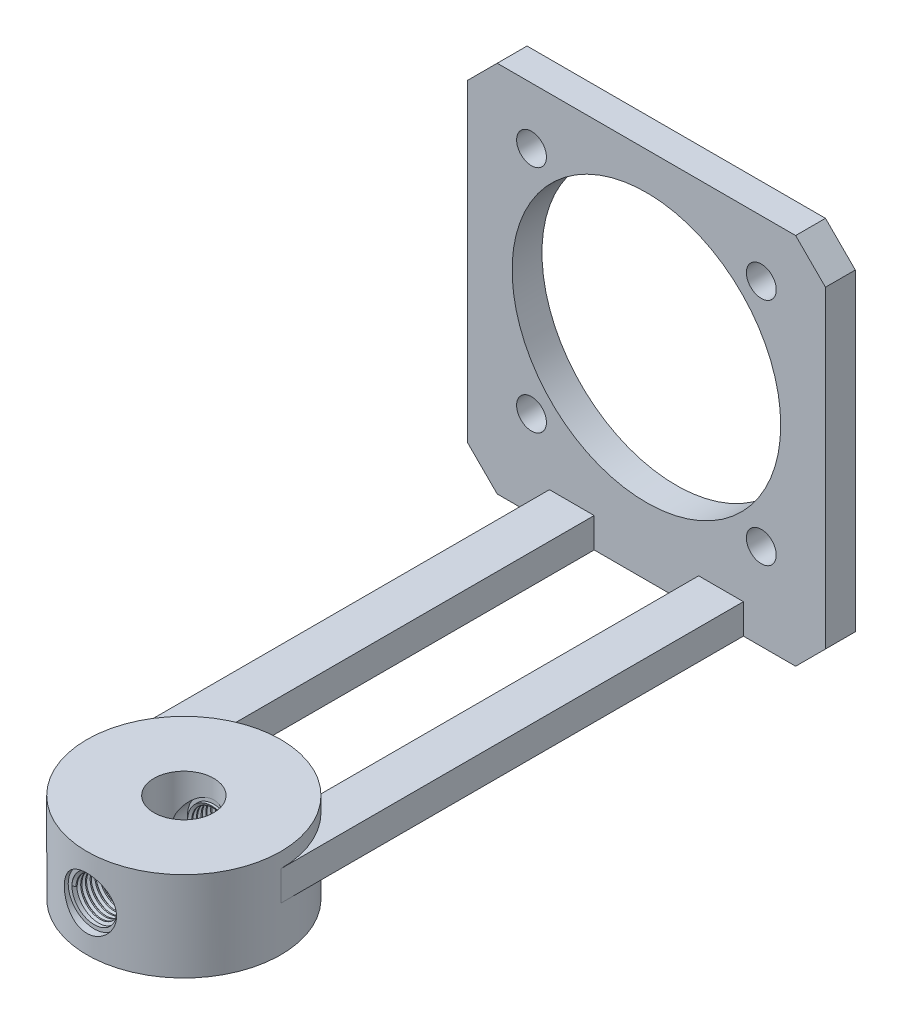
from build123d import *

# Parameters (mm, degrees)
SKETCH_2_R           = 6.5
EXTRUDE_1_DEPTH      = 2
SKETCH_3_R           = 2
CUT_EXTRUDE_2_DEPTH  = 5
EXTRUDE_START        = -2
EXTRUDE_2_DEPTH      = 2
EXTRUDE_3_DEPTH      = 2
SKETCH_22_R          = 9
SKETCH_22_R_2        = 1
CUT_EXTRUDE_4_DEPTH  = 2
CHAMFER_1_SIZE       = 2
CUT_EXTRUDE_5_DEPTH  = 10
SKETCH_26_R          = 6.5
EXTRUDE_5_DEPTH      = 1
EXTRUDE_START_2      = 3
SKETCH_27_R          = 6.5
EXTRUDE_6_DEPTH      = 3
SKETCH_28_R          = 2
CUT_EXTRUDE_7_DEPTH  = 45.911023146
SKETCH_29_R          = 1.75
CUT_EXTRUDE_8_DEPTH  = 2
SKETCH_54_R          = 1.5
CUT_EXTRUDE_10_DEPTH = 4
SKETCH_55_R          = 1.75
CUT_EXTRUDE_11_DEPTH = 4
THREAD_6_PITCH       = 0.3175
CUT_EXTRUDE_START    = -4
SKETCH_60_R          = 1.5
CUT_EXTRUDE_12_DEPTH = 4
SKETCH_61_R          = 1.75
CUT_EXTRUDE_13_DEPTH = 4
THREAD_7_PITCH       = 0.3175


with BuildPart() as part:
    # 草图2 → 凸台-拉伸1 (new body)
    with BuildSketch(Plane(origin=(0, 0, 0), x_dir=(1, 0, 0), z_dir=(0, 1, 0))):
        with Locations(Location((0, 0, 0), (0, 0, 270))):
            Circle(SKETCH_2_R)
    extrude(amount=EXTRUDE_1_DEPTH)

    # 草图3 → 切除-拉伸2 (cut, symmetric)
    with BuildSketch(Plane(origin=(0, 2, 0), x_dir=(1, 0, 0), z_dir=(0, 1, 0))):
        with Locations(Location((0, 0, 0), (0, 0, 270))):
            Circle(SKETCH_3_R)
    extrude(amount=CUT_EXTRUDE_2_DEPTH, both=True, mode=Mode.SUBTRACT)

    # 草图4 → 凸台-拉伸2 (add)
    with BuildSketch(Plane(origin=(0, 2, 0), x_dir=(1, 0, 0), z_dir=(0, 1, 0)).offset(EXTRUDE_START)):
        with BuildLine():
            Line((6.5, 0), (6.5, 31))
            Line((6.5, 31), (3.899148682, 31))
            Line((3.899148682, 31), (-4.100851318, 31))
            Line((-4.100851318, 31), (-6.5, 31))
            Line((-6.5, 31), (-6.5, 0))
            ThreePointArc((-6.5, 0), (0, 6.5), (6.5, 0))
        make_face()
    extrude(amount=EXTRUDE_2_DEPTH)

    # 草图21 → 凸台-拉伸3 (add)
    with BuildSketch(Plane(origin=(0, 0, -31), x_dir=(-1, 0, 0), z_dir=(0, 0, -1))):
        Polygon((0, 0), (12, 0), (12, 25), (-12, 25), (-12, 0), align=None)
    extrude(amount=EXTRUDE_3_DEPTH)

    # 草图22 → 切除-拉伸4 (cut)
    with BuildSketch(Plane.XY.offset(-31)):
        with Locations((0, 13.5)):
            Circle(SKETCH_22_R)
        with Locations((7.7, 21.2)):
            Circle(SKETCH_22_R_2)
        with Locations((-7.7, 21.2)):
            Circle(SKETCH_22_R_2)
        with Locations((-7.7, 5.8)):
            Circle(SKETCH_22_R_2)
        with Locations((7.7, 5.8)):
            Circle(SKETCH_22_R_2)
    extrude(amount=-CUT_EXTRUDE_4_DEPTH, mode=Mode.SUBTRACT)

    # 倒角1
    chamfer_1_edges = [part.edges().sort_by_distance(p)[0] for p in [
        (12, 0, -32),
        (-12, 0, -32),
        (-12, 25, -32),
        (12, 25, -32),
    ]]
    chamfer(chamfer_1_edges, length=CHAMFER_1_SIZE)

    # 草图23 → 切除-拉伸5 (cut)
    with BuildSketch(Plane.XZ):
        with BuildLine():
            ThreePointArc((3.5, -5.477225575), (0, -6.5), (-3.5, -5.477225575))
            Line((-3.5, -5.477225575), (-3.5, -31))
            Line((-3.5, -31), (3.5, -31))
            Line((3.5, -31), (3.5, -5.477225575))
        make_face()
    extrude(amount=-CUT_EXTRUDE_5_DEPTH, mode=Mode.SUBTRACT)

    # 草图26 → 凸台-拉伸5 (add)
    with BuildSketch(Plane(origin=(0, 2, 0), x_dir=(1, 0, 0), z_dir=(0, 1, 0))):
        with Locations(Location((0, 0, 0), (0, 0, 57.421029607))):
            Circle(SKETCH_26_R)
    extrude(amount=EXTRUDE_5_DEPTH)

    # 草图27 → 凸台-拉伸6 (add)
    with BuildSketch(Plane.XZ.offset(EXTRUDE_START_2)):
        with Locations(Location((0, 0, 0), (0, 0, 270))):
            Circle(SKETCH_27_R)
    extrude(amount=-EXTRUDE_6_DEPTH)

    # 草图28 → 切除-拉伸7 (cut, through all)
    with BuildSketch(Plane.XZ.offset(3)):
        with Locations(Location((0, 0, 0), (0, 0, 90))):
            Circle(SKETCH_28_R)
    extrude(amount=-CUT_EXTRUDE_7_DEPTH, mode=Mode.SUBTRACT)

    # 草图29 → 切除-拉伸8 (cut, symmetric)
    with BuildSketch(Plane.XY):
        Circle(SKETCH_29_R)
    extrude(amount=CUT_EXTRUDE_8_DEPTH, both=True, mode=Mode.SUBTRACT)

    # 草图54 → 切除-拉伸10 (cut)
    with BuildSketch(Plane.XY.offset(-2)):
        Circle(SKETCH_54_R)
    extrude(amount=-CUT_EXTRUDE_10_DEPTH, mode=Mode.SUBTRACT)

    # 草图55 → 切除-拉伸11 (cut)
    with BuildSketch(Plane.XY.offset(-6)):
        Circle(SKETCH_55_R)
    extrude(amount=-CUT_EXTRUDE_11_DEPTH, mode=Mode.SUBTRACT)

    # 螺纹线6: arcs per turn and ends read off the stored shape
    # 螺纹线6: the profile of 螺纹线轮廓10 profile screwed along a right-hand helix through 12.598425 turns, 6 arcs to a turn; built about Z, then put on its axis
    thread_6_z = Axis((0, 0, 0), (0, 0, 1))
    thread_6_corners = [(1.5003, 0, -0.000173205), (1.5003, 0, 0.277985704), (1.328148085, 0, 0.17859375), (1.328148085, 0, 0.09921875)]
    with BuildLine(mode=Mode.PRIVATE) as thread_6_profile:
        Line(thread_6_corners[0], thread_6_corners[1])
        Line(thread_6_corners[1], thread_6_corners[2])
        Line(thread_6_corners[2], thread_6_corners[3])
        Line(thread_6_corners[3], thread_6_corners[0])
    thread_6_cap = Face(thread_6_profile.wire())
    thread_6_turn_angles = [0, 30, 60, 90, 120, 150, 180, 210, 240, 270, 300, 330, 360]
    thread_6_turn_weights = [1, 0.8660254037844387, 1, 0.8660254037844387, 1, 0.8660254037844387, 1, 0.8660254037844387, 1, 0.8660254037844387, 1, 0.8660254037844387, 1]
    thread_6_turn_rails = [Edge.make_bspline([Vector(p[0], p[1], 0).rotate(thread_6_z, thread_6_turn_angles[k]) / thread_6_turn_weights[k] + Vector(0, 0, p[2] + THREAD_6_PITCH * thread_6_turn_angles[k] / 360) for k in range(13)], [0, 0, 0, 1, 1, 2, 2, 3, 3, 4, 4, 5, 5, 6, 6, 6], 2, thread_6_turn_weights) for p in thread_6_corners]
    thread_6_turn_sides = [Face.make_surface_from_curves(thread_6_turn_rails[p[0]], thread_6_turn_rails[p[1]]) for p in [(0, 1), (1, 2), (2, 3), (3, 0)]]
    thread_6_last_angles = [4320, 4350, 4380, 4410, 4440, 4470, 4500, 4517.716535433, 4535.433070866]
    thread_6_last_weights = [1, 0.8660254037844387, 1, 0.8660254037844387, 1, 0.8660254037844387, 1, 0.9525736983244454, 1]
    thread_6_last_rails = [Edge.make_bspline([Vector(p[0], p[1], 0).rotate(thread_6_z, thread_6_last_angles[k]) / thread_6_last_weights[k] + Vector(0, 0, p[2] + THREAD_6_PITCH * thread_6_last_angles[k] / 360) for k in range(9)], [0, 0, 0, 1, 1, 2, 2, 3, 3, 4, 4, 4], 2, thread_6_last_weights) for p in thread_6_corners]
    thread_6_last_sides = [Face.make_surface_from_curves(thread_6_last_rails[p[0]], thread_6_last_rails[p[1]]) for p in [(0, 1), (1, 2), (2, 3), (3, 0)]]
    thread_6 = Plane(origin=(0, 0, -6), x_dir=(1, 0, 0), z_dir=(0, 0, 1)) * Solid(Shell([*[p.moved(Location((0, 0, THREAD_6_PITCH * i))) for i in range(12) for p in thread_6_turn_sides], *thread_6_last_sides, thread_6_cap, thread_6_cap.rotate(thread_6_z, 4535.433070866).moved(Location((0, 0, THREAD_6_PITCH * 4535.433070866 / 360)))]))
    add(thread_6)

    # 草图60 → 切除-拉伸12 (cut)
    with BuildSketch(Plane(origin=(0, 0, 2), x_dir=(-1, 0, 0), z_dir=(0, 0, -1)).offset(CUT_EXTRUDE_START)):
        Circle(SKETCH_60_R)
    extrude(amount=CUT_EXTRUDE_12_DEPTH, mode=Mode.SUBTRACT)

    # 草图61 → 切除-拉伸13 (cut)
    with BuildSketch(Plane(origin=(0, 0, 6), x_dir=(-1, 0, 0), z_dir=(0, 0, -1)).offset(CUT_EXTRUDE_START)):
        with Locations(Location((0, 0, 0), (0, 0, 180))):
            Circle(SKETCH_61_R)
    extrude(amount=CUT_EXTRUDE_13_DEPTH, mode=Mode.SUBTRACT)

    # 螺纹线7: arcs per turn and ends read off the stored shape
    # 螺纹线7: the profile of 螺纹线轮廓11 profile screwed along a right-hand helix through 12.598425 turns, 6 arcs to a turn; built about Z, then put on its axis
    thread_7_z = Axis((0, 0, 0), (0, 0, 1))
    thread_7_corners = [(1.5003, 0, -0.000173205), (1.5003, 0, 0.277985704), (1.328148085, 0, 0.17859375), (1.328148085, 0, 0.09921875)]
    with BuildLine(mode=Mode.PRIVATE) as thread_7_profile:
        Line(thread_7_corners[0], thread_7_corners[1])
        Line(thread_7_corners[1], thread_7_corners[2])
        Line(thread_7_corners[2], thread_7_corners[3])
        Line(thread_7_corners[3], thread_7_corners[0])
    thread_7_cap = Face(thread_7_profile.wire())
    thread_7_turn_angles = [0, 30, 60, 90, 120, 150, 180, 210, 240, 270, 300, 330, 360]
    thread_7_turn_weights = [1, 0.8660254037844387, 1, 0.8660254037844387, 1, 0.8660254037844387, 1, 0.8660254037844387, 1, 0.8660254037844387, 1, 0.8660254037844387, 1]
    thread_7_turn_rails = [Edge.make_bspline([Vector(p[0], p[1], 0).rotate(thread_7_z, thread_7_turn_angles[k]) / thread_7_turn_weights[k] + Vector(0, 0, p[2] + THREAD_7_PITCH * thread_7_turn_angles[k] / 360) for k in range(13)], [0, 0, 0, 1, 1, 2, 2, 3, 3, 4, 4, 5, 5, 6, 6, 6], 2, thread_7_turn_weights) for p in thread_7_corners]
    thread_7_turn_sides = [Face.make_surface_from_curves(thread_7_turn_rails[p[0]], thread_7_turn_rails[p[1]]) for p in [(0, 1), (1, 2), (2, 3), (3, 0)]]
    thread_7_last_angles = [4320, 4350, 4380, 4410, 4440, 4470, 4500, 4517.716535433, 4535.433070866]
    thread_7_last_weights = [1, 0.8660254037844387, 1, 0.8660254037844387, 1, 0.8660254037844387, 1, 0.9525736983244454, 1]
    thread_7_last_rails = [Edge.make_bspline([Vector(p[0], p[1], 0).rotate(thread_7_z, thread_7_last_angles[k]) / thread_7_last_weights[k] + Vector(0, 0, p[2] + THREAD_7_PITCH * thread_7_last_angles[k] / 360) for k in range(9)], [0, 0, 0, 1, 1, 2, 2, 3, 3, 4, 4, 4], 2, thread_7_last_weights) for p in thread_7_corners]
    thread_7_last_sides = [Face.make_surface_from_curves(thread_7_last_rails[p[0]], thread_7_last_rails[p[1]]) for p in [(0, 1), (1, 2), (2, 3), (3, 0)]]
    thread_7 = Plane(origin=(0, 0, 6), x_dir=(-1, 0, 0), z_dir=(0, 0, -1)) * Solid(Shell([*[p.moved(Location((0, 0, THREAD_7_PITCH * i))) for i in range(12) for p in thread_7_turn_sides], *thread_7_last_sides, thread_7_cap, thread_7_cap.rotate(thread_7_z, 4535.433070866).moved(Location((0, 0, THREAD_7_PITCH * 4535.433070866 / 360)))]))
    add(thread_7)


solid = part.part
